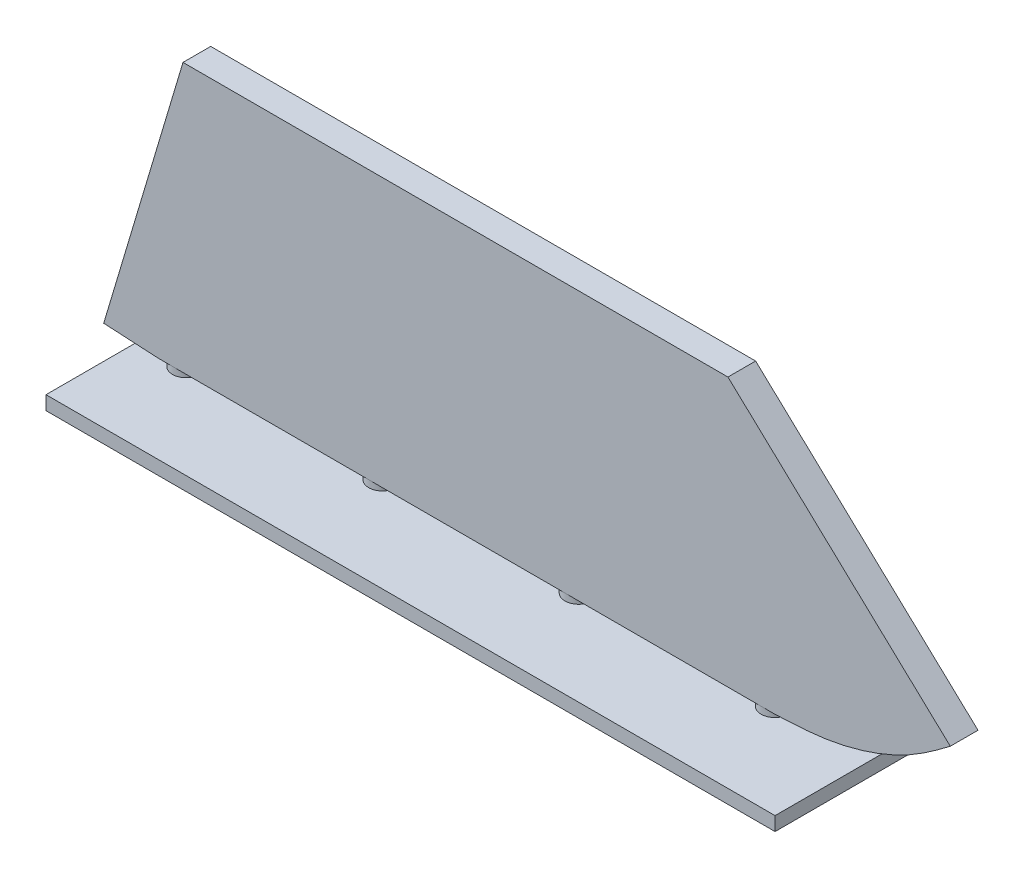
from build123d import *

# Parameters (mm, degrees)
EXTRUDE_1_DEPTH     = 1.2
CUT_EXTRUDE_START   = -1.2
CUT_EXTRUDE_1_DEPTH = 1.2
SKETCH_3_R          = 0.6
EXTRUDE_2_DEPTH     = 0.3
SKETCH_4_W          = 31.58406245
SKETCH_4_H          = 7.800680058
EXTRUDE_3_DEPTH     = 0.6


# Read off the part's stored shape, not the designer's step: Вырез-Вытянуть-Тонкостенный1
with BuildPart() as part:
    # Эскиз1 → Бобышка-Вытянуть1 (new body)
    with BuildSketch(Plane.XY):
        with BuildLine():
            Line((-18.4888994, -6.081212357), (-16.002013835, -6.217213911))
            Line((-16.002013835, -6.217213911), (10.732005982, -6.217213911))
            add(Edge.make_bspline(
                [(10.732005982, -6.217213911), (11.47341135, -6.18385268), (12.922426791, -6.118650915), (15.00936311, -5.600631561), (16.935457079, -4.747576966), (18.044624718, -3.914711141), (18.600667338, -3.497182825)],
                knots=[0, 0, 0, 0, 0.261630689, 0.511335532, 0.755025064, 1, 1, 1, 1], degree=3))
            Line((18.600667338, -3.497182825), (18.870975113, -3.202301616))
            Line((18.870975113, -3.202301616), (8.829771562, 6.217213911))
            Line((8.829771562, 6.217213911), (-15.234306629, 6.217213911))
            Line((-15.234306629, 6.217213911), (-18.870975113, -5.962739267))
            Line((-18.870975113, -5.962739267), (-18.4888994, -6.081212357))
        make_face()
    extrude(amount=EXTRUDE_1_DEPTH)

    # Вырез-Вытянуть-Тонкостенный1 outline → Вырез-Вытянуть-Тонкостенный1 (cut)
    with BuildSketch(Plane.XY.offset(1.2).offset(CUT_EXTRUDE_START)):
        with BuildLine():
            Line((-16.002013835, -6.217213911), (10.732005982, -6.217213911))
            add(Edge.make_bspline(
                [(10.732005982, -6.217213911), (11.47341135, -6.18385268), (12.922426791, -6.118650915), (15.00936311, -5.600631561), (16.935457079, -4.747576966), (18.044624718, -3.914711141), (18.600667338, -3.497182825)],
                knots=[0, 0, 0, 0, 0.261630689, 0.511335532, 0.755025064, 1, 1, 1, 1], degree=3))
            Line((18.600667338, -3.497182825), (18.870975113, -3.202301616))
            Line((18.870975113, -3.202301616), (8.829771562, 6.217213911))
            Line((8.829771562, 6.217213911), (-15.234306629, 6.217213911))
            Line((-15.234306629, 6.217213911), (-18.870975113, -5.962739267))
            Line((-18.870975113, -5.962739267), (-18.4888994, -6.081212357))
            Line((-18.4888994, -6.081212357), (-16.002013835, -6.217213911))
        make_face()
        with BuildLine():
            add(Edge.make_bspline(
                [(10.723010965, -5.817213911), (11.406644912, -5.786451106), (12.090314496, -5.756131603), (13.447652329, -5.571081257), (14.109804636, -5.413655126), (15.071741231, -5.094978106), (15.387815329, -4.97510238), (16.009307585, -4.703532881), (16.315751157, -4.551234574), (17.2086095, -4.040085881), (17.756993168, -3.630363934), (18.304501391, -3.219353606)],
                knots=[0, 0, 0, 0, 0.25, 0.25, 0.5, 0.5, 0.625, 0.625, 0.75, 0.75, 1, 1, 1, 1], degree=3))
            Line((10.723010965, -5.817213911), (-15.991084501, -5.817213911))
            Line((-15.991084501, -5.817213911), (-18.37121133, -5.687050725))
            Line((-18.37121133, -5.687050725), (-14.936288713, 5.817213911))
            Line((-14.936288713, 5.817213911), (8.671520418, 5.817213911))
            Line((8.671520418, 5.817213911), (18.304501391, -3.219353606))
        make_face(mode=Mode.SUBTRACT)
    extrude(amount=CUT_EXTRUDE_1_DEPTH, mode=Mode.SUBTRACT)

    # Эскиз3 → Бобышка-Вытянуть2 (add)
    with BuildSketch(Plane.XZ.offset(5.817213911)):
        with Locations(Location((-15.391084501, 0.6, 0), (0, 0, 270))):
            Circle(SKETCH_3_R)
        with Locations(Location((-6.891084501, 0.6, 0), (0, 0, 270))):
            Circle(SKETCH_3_R)
        with Locations(Location((1.608915499, 0.6, 0), (0, 0, 270))):
            Circle(SKETCH_3_R)
        with Locations(Location((10.108915499, 0.6, 0), (0, 0, 270))):
            Circle(SKETCH_3_R)
    extrude(amount=EXTRUDE_2_DEPTH)

    # Эскиз4 → Бобышка-Вытянуть3 (add)
    with BuildSketch(Plane.XZ.offset(6.117213911)):
        with Locations((-1.579371694, 0.79934669)):
            Rectangle(SKETCH_4_W, SKETCH_4_H)
    extrude(amount=EXTRUDE_3_DEPTH)


solid = part.part
